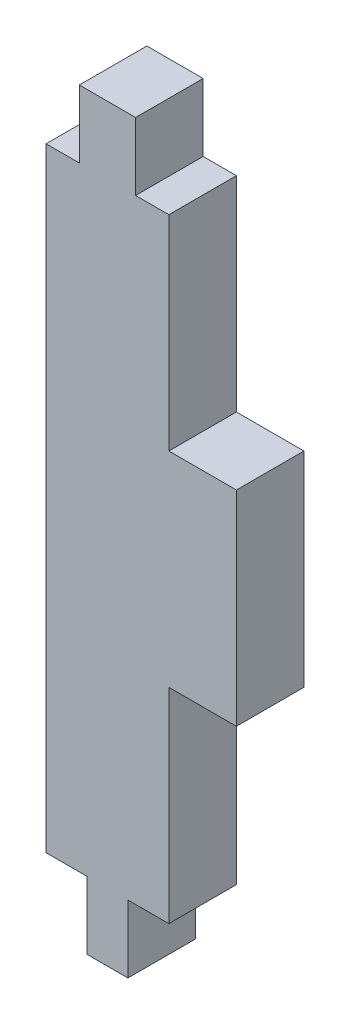
from build123d import *

# Parameters (mm, degrees)
SKETCH1_W           = 4.583333334
SKETCH1_H           = 11
SKETCH1_W_2         = 10
SKETCH1_H_2         = 50
SKETCH1_W_3         = 3.333333334
SKETCH1_W_4         = 5.5
SKETCH1_H_3         = 16.666666667
BOSS_EXTRUDE1_DEPTH = 5.5


with BuildPart() as part:
    # Sketch1 → Boss-Extrude1 (new body)
    with BuildSketch(Plane.XY):
        with Locations((-32.230609748, -16.180003411)):
            Rectangle(SKETCH1_W, SKETCH1_H)
        with Locations((-32.230609748, -41.180003411)):
            Rectangle(SKETCH1_W_2, SKETCH1_H_2)
        with Locations((-32.230609748, -66.180003411)):
            Rectangle(SKETCH1_W_3, SKETCH1_H)
        with Locations((-24.480609748, -41.18000341)):
            Rectangle(SKETCH1_W_4, SKETCH1_H_3)
    extrude(amount=BOSS_EXTRUDE1_DEPTH)


solid = part.part
